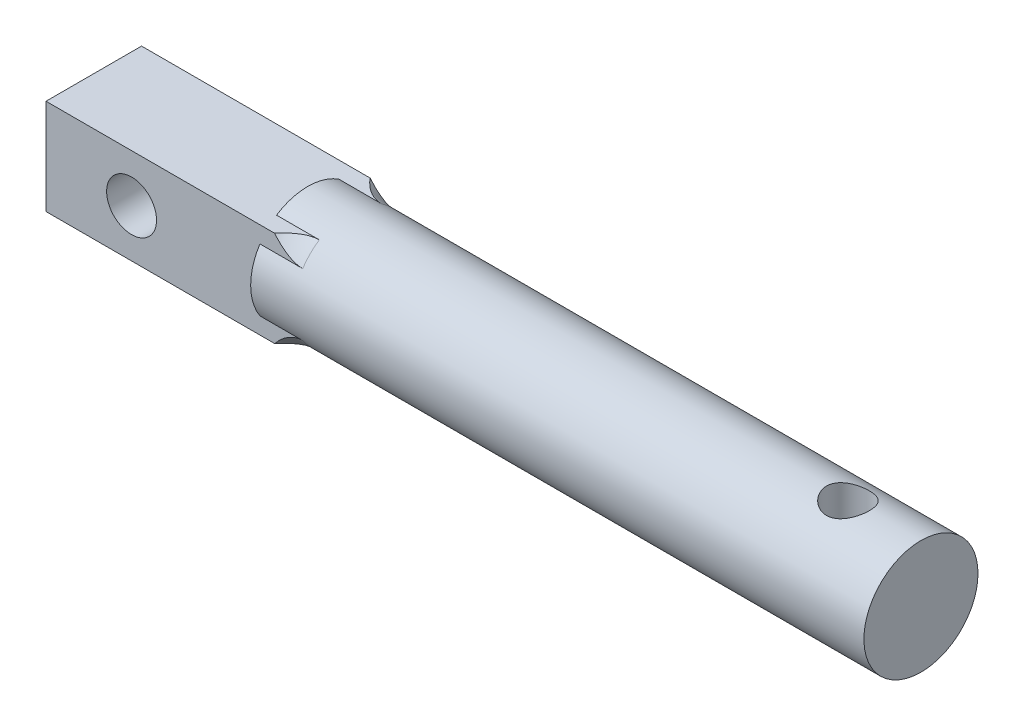
from build123d import *

# Parameters (mm, degrees)
ESQUISSE1_W                  = 6.7
ESQUISSE1_H                  = 6.7
BOSS_EXTRU_1_DEPTH           = 15
ESQUISSE2_R                  = 4
BOSS_EXTRU_2_DEPTH           = 43
ENL_V_MAT_EXTRU_1_DEPTH      = 59.275209137
ENL_V_MAT_EXTRU_1_DEPTH_BACK = 59.275209137
ESQUISSE3_R                  = 1.5
CONG_1_R                     = 3
ENL_V_MAT_EXTRU_2_DEPTH      = 59.600533392
ENL_V_MAT_EXTRU_2_DEPTH_BACK = 59.600533392
ESQUISSE4_R                  = 1.75


with BuildPart() as part:
    # Esquisse1 → Boss.-Extru.1 (new body)
    with BuildSketch(Plane.YZ):
        Rectangle(ESQUISSE1_W, ESQUISSE1_H)
    extrude(amount=BOSS_EXTRU_1_DEPTH)

    # Esquisse2 → Boss.-Extru.2 (add)
    with BuildSketch(Plane.YZ.offset(15)):
        with Locations(Location((0, 0, 0), (0, 0, 56.877059792))):
            Circle(ESQUISSE2_R)
    extrude(amount=BOSS_EXTRU_2_DEPTH)

    # Esquisse3 → Enlèv. mat.-Extru.1 (cut, two sides: drawn at the far end of the back side and taken through both)
    with BuildSketch(Plane(origin=(0, 0, 0), x_dir=(-1, 0, 0), z_dir=(0, 1, 0)).offset(-ENL_V_MAT_EXTRU_1_DEPTH_BACK)):
        with Locations(Location((-52.88, 0, 0), (0, 0, 90))):
            Circle(ESQUISSE3_R)
    extrude(amount=ENL_V_MAT_EXTRU_1_DEPTH + ENL_V_MAT_EXTRU_1_DEPTH_BACK, mode=Mode.SUBTRACT)

    # Congé1
    # the kernel refuses this fillet: 3 mm, written as the material it adds along each edge
    with BuildSketch(Plane(origin=(15, 0, 0), x_dir=(0, -0.9627373172303846, -0.27043827024302985), z_dir=(0, -0.27043827024302985, 0.9627373172303846))) as cong_1_piece_1_section:
        with BuildLine():
            CenterArc((4 + CONG_1_R, CONG_1_R), CONG_1_R, 180, 90)
            Line((4 + CONG_1_R, 0), (4, 0))
            Line((4, 0), (4, CONG_1_R))
        make_face()
    cong_1_piece_1 = revolve(axis=Axis((15, 0, 0), (1, 0, 0)), revolution_arc=238.619303718, mode=Mode.PRIVATE)
    cong_1_piece_1 = split(cong_1_piece_1, bisect_by=Plane(origin=(16.010494669, -2.96099487, 3.35), z_dir=(0, 0, -1)), keep=Keep.TOP, mode=Mode.PRIVATE)
    cong_1_piece_1 = split(cong_1_piece_1, bisect_by=Plane(origin=(16.010494669, -2.96099487, -3.35), z_dir=(0, 0, 1)), keep=Keep.TOP, mode=Mode.PRIVATE)
    cong_1_piece_1 = split(cong_1_piece_1, bisect_by=Plane(origin=(16.010494669, 3.35, -2.96099477), z_dir=(0, -1, 0)), keep=Keep.TOP, mode=Mode.PRIVATE)
    cong_1_piece_1 = split(cong_1_piece_1, bisect_by=Plane(origin=(16.010494669, -3.35, -2.96099477), z_dir=(0, 1, 0)), keep=Keep.TOP, mode=Mode.PRIVATE)
    add(cong_1_piece_1)
    with BuildSketch(Plane(origin=(15, 0, 0), x_dir=(0, 0.27043827024295675, -0.962737317230405), z_dir=(0, -0.962737317230405, -0.27043827024295675))) as cong_1_piece_2_section:
        with BuildLine():
            CenterArc((4 + CONG_1_R, CONG_1_R), CONG_1_R, 180, 90)
            Line((4 + CONG_1_R, 0), (4, 0))
            Line((4, 0), (4, CONG_1_R))
        make_face()
    cong_1_piece_2 = revolve(axis=Axis((15, 0, 0), (1, 0, 0)), revolution_arc=238.619303718, mode=Mode.PRIVATE)
    cong_1_piece_2 = split(cong_1_piece_2, bisect_by=Plane(origin=(16.010494669, 2.96099477, 3.35), z_dir=(0, 0, -1)), keep=Keep.TOP, mode=Mode.PRIVATE)
    cong_1_piece_2 = split(cong_1_piece_2, bisect_by=Plane(origin=(16.010494669, 2.96099477, -3.35), z_dir=(0, 0, 1)), keep=Keep.TOP, mode=Mode.PRIVATE)
    cong_1_piece_2 = split(cong_1_piece_2, bisect_by=Plane(origin=(16.010494669, 3.35, -2.96099487), z_dir=(0, -1, 0)), keep=Keep.TOP, mode=Mode.PRIVATE)
    cong_1_piece_2 = split(cong_1_piece_2, bisect_by=Plane(origin=(16.010494669, -3.35, -2.96099487), z_dir=(0, 1, 0)), keep=Keep.TOP, mode=Mode.PRIVATE)
    add(cong_1_piece_2)
    with BuildSketch(Plane(origin=(15, 0, 0), x_dir=(0, 0.9627373172304061, 0.27043827024295286), z_dir=(0, 0.27043827024295286, -0.9627373172304061))) as cong_1_piece_3_section:
        with BuildLine():
            CenterArc((4 + CONG_1_R, CONG_1_R), CONG_1_R, 180, 90)
            Line((4 + CONG_1_R, 0), (4, 0))
            Line((4, 0), (4, CONG_1_R))
        make_face()
    cong_1_piece_3 = revolve(axis=Axis((15, 0, 0), (1, 0, 0)), revolution_arc=238.619303718, mode=Mode.PRIVATE)
    cong_1_piece_3 = split(cong_1_piece_3, bisect_by=Plane(origin=(16.010494669, 2.96099487, 3.35), z_dir=(0, 0, -1)), keep=Keep.TOP, mode=Mode.PRIVATE)
    cong_1_piece_3 = split(cong_1_piece_3, bisect_by=Plane(origin=(16.010494669, 2.96099487, -3.35), z_dir=(0, 0, 1)), keep=Keep.TOP, mode=Mode.PRIVATE)
    cong_1_piece_3 = split(cong_1_piece_3, bisect_by=Plane(origin=(16.010494669, 3.35, 2.96099477), z_dir=(0, -1, 0)), keep=Keep.TOP, mode=Mode.PRIVATE)
    cong_1_piece_3 = split(cong_1_piece_3, bisect_by=Plane(origin=(16.010494669, -3.35, 2.96099477), z_dir=(0, 1, 0)), keep=Keep.TOP, mode=Mode.PRIVATE)
    add(cong_1_piece_3)
    with BuildSketch(Plane(origin=(15, 0, 0), x_dir=(0, -0.2704382702430083, 0.9627373172303906), z_dir=(0, 0.9627373172303906, 0.2704382702430083))) as cong_1_piece_4_section:
        with BuildLine():
            CenterArc((4 + CONG_1_R, CONG_1_R), CONG_1_R, 180, 90)
            Line((4 + CONG_1_R, 0), (4, 0))
            Line((4, 0), (4, CONG_1_R))
        make_face()
    cong_1_piece_4 = revolve(axis=Axis((15, 0, 0), (1, 0, 0)), revolution_arc=238.619303718, mode=Mode.PRIVATE)
    cong_1_piece_4 = split(cong_1_piece_4, bisect_by=Plane(origin=(16.010494669, -2.96099477, 3.35), z_dir=(0, 0, -1)), keep=Keep.TOP, mode=Mode.PRIVATE)
    cong_1_piece_4 = split(cong_1_piece_4, bisect_by=Plane(origin=(16.010494669, -2.96099477, -3.35), z_dir=(0, 0, 1)), keep=Keep.TOP, mode=Mode.PRIVATE)
    cong_1_piece_4 = split(cong_1_piece_4, bisect_by=Plane(origin=(16.010494669, 3.35, 2.96099487), z_dir=(0, -1, 0)), keep=Keep.TOP, mode=Mode.PRIVATE)
    cong_1_piece_4 = split(cong_1_piece_4, bisect_by=Plane(origin=(16.010494669, -3.35, 2.96099487), z_dir=(0, 1, 0)), keep=Keep.TOP, mode=Mode.PRIVATE)
    add(cong_1_piece_4)

    # Esquisse4 → Enlèv. mat.-Extru.2 (cut, two sides: drawn at the far end of the back side and taken through both)
    with BuildSketch(Plane(origin=(0, 0, 3.35), x_dir=(-1, 0, 0), z_dir=(0, 0, -1)).offset(-ENL_V_MAT_EXTRU_2_DEPTH_BACK)):
        with Locations(Location((-6, 0, 0), (0, 0, 180))):
            Circle(ESQUISSE4_R)
    extrude(amount=ENL_V_MAT_EXTRU_2_DEPTH + ENL_V_MAT_EXTRU_2_DEPTH_BACK, mode=Mode.SUBTRACT)


solid = part.part
